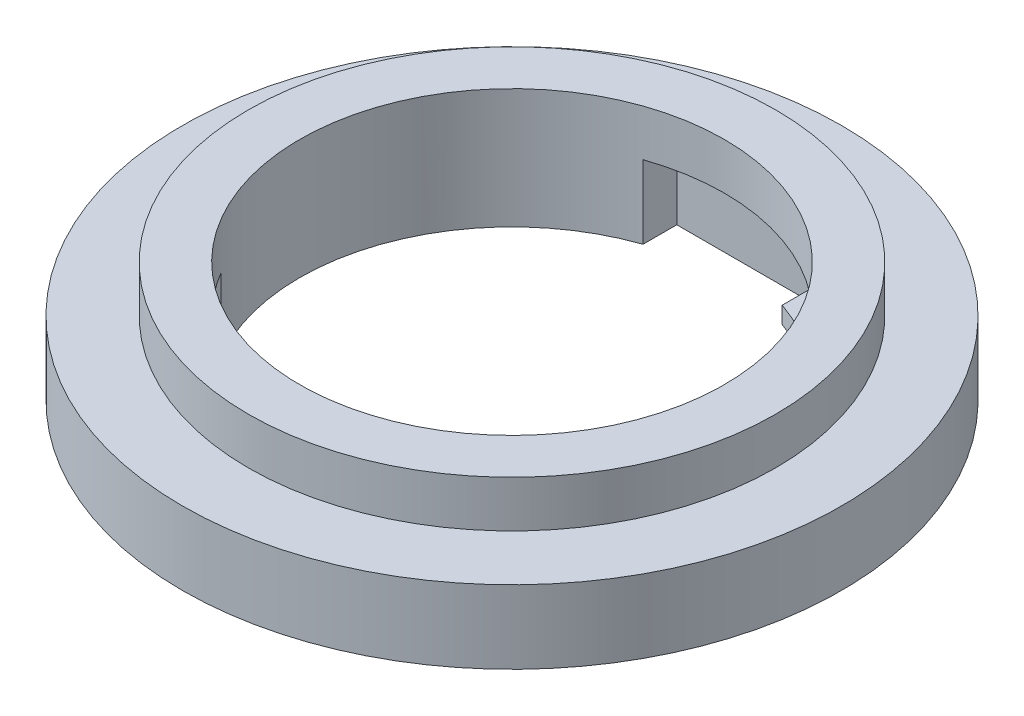
from build123d import *

# Parameters (mm, degrees)
SKETCH1_R           = 36
BOSS_EXTRUDE1_DEPTH = 6.35
SKETCH2_R           = 29
CUT_EXTRUDE1_DEPTH  = 52.306164347
BOSS_EXTRUDE2_START = 10
SKETCH3_R           = 45
SKETCH3_R_2         = 29
BOSS_EXTRUDE2_DEPTH = 10
CUT_EXTRUDE2_DEPTH  = 10
CUT_SWEEP1_START    = -7.7
CUT_SWEEP1_DEPTH    = 7.7
CUT_SWEEP2_START    = -7.7
CUT_SWEEP2_DEPTH    = 7.7


# Read off the part's stored shape, not the designer's step: Cut-Sweep1, Cut-Sweep2
with BuildPart() as part:
    # Sketch1 → Boss-Extrude1 (new body)
    with BuildSketch(Plane(origin=(0, 0, 0), x_dir=(1, 0, 0), z_dir=(0, 1, 0))):
        with Locations(Location((0, 0, 0), (0, 0, 270))):
            Circle(SKETCH1_R)
    extrude(amount=BOSS_EXTRUDE1_DEPTH)

    # Sketch2 → Cut-Extrude1 (cut, through all)
    with BuildSketch(Plane(origin=(0, 0, 0), x_dir=(-1, 0, 0), z_dir=(0, -1, 0))):
        with Locations(Location((0, 0, 0), (0, 0, 90))):
            Circle(SKETCH2_R)
    extrude(amount=-CUT_EXTRUDE1_DEPTH, mode=Mode.SUBTRACT)

    # Sketch3 → Boss-Extrude2 (add)
    with BuildSketch(Plane.XZ.offset(BOSS_EXTRUDE2_START)):
        with Locations(Location((0, 0, 0), (0, 0, 270))):
            Circle(SKETCH3_R)
        with Locations(Location((0, 0, 0), (0, 0, 270))):
            Circle(SKETCH3_R_2, mode=Mode.SUBTRACT)
    extrude(amount=-BOSS_EXTRUDE2_DEPTH)

    # Sketch6 → Cut-Extrude2 (cut)
    with BuildSketch(Plane(origin=(0, -10, 0), x_dir=(-1, 0, 0), z_dir=(0, -1, 0))):
        with BuildLine():
            Line((9.5, -29), (9.5, -27.399817518))
            ThreePointArc((9.5, -27.399817518), (0, -29), (-9.5, -27.399817518))
            Line((-9.5, -27.399817518), (-9.5, -29))
            Line((-9.5, -29), (-9.5, -32))
            Line((-9.5, -32), (9.5, -32))
            Line((9.5, -32), (9.5, -29))
        make_face()
        with BuildLine():
            Line((9.5, 29), (9.5, 27.399817518))
            ThreePointArc((9.5, 27.399817518), (0, 29), (-9.5, 27.399817518))
            Line((-9.5, 27.399817518), (-9.5, 29))
            Line((-9.5, 29), (-9.5, 32))
            Line((-9.5, 32), (9.5, 32))
            Line((9.5, 32), (9.5, 29))
        make_face()
    extrude(amount=-CUT_EXTRUDE2_DEPTH, mode=Mode.SUBTRACT)

    # Cut-Sweep1 outline → Cut-Sweep1 (cut)
    with BuildSketch(Plane(origin=(0, 0, 0), x_dir=(1, 0, 0), z_dir=(0, 1, 0)).offset(CUT_SWEEP1_START)):
        with BuildLine():
            add(Edge.make_bspline(
                [(9.5, 32), (13.238484468, 30.894081247), (16.809709604, 29.105075442), (23.154704566, 24.372448809), (25.850694666, 21.46020132), (27.956173262, 18.240130935)],
                knots=[0.04905898, 0.04905898, 0.04905898, 0.04905898, 0.52452949, 0.52452949, 1, 1, 1, 1], degree=3))
            Line((9.5, 32), (9.5, 27.399817518))
            ThreePointArc((9.5, 27.399817518), (18.365540323, 22.443416154), (24.978218037, 14.73392764))
            Line((24.978218037, 14.73392764), (27.956173262, 18.240130935))
        make_face()
    extrude(amount=CUT_SWEEP1_DEPTH, mode=Mode.SUBTRACT)

    # Cut-Sweep2 outline → Cut-Sweep2 (cut)
    with BuildSketch(Plane(origin=(0, 0, 0), x_dir=(1, 0, 0), z_dir=(0, 1, 0)).offset(CUT_SWEEP2_START)):
        with BuildLine():
            add(Edge.make_bspline(
                [(-9.5, -32), (-13.238484468, -30.894081248), (-16.809709604, -29.105075442), (-23.154704566, -24.372448809), (-25.850694666, -21.46020132), (-27.956173262, -18.240130935)],
                knots=[0.04905898, 0.04905898, 0.04905898, 0.04905898, 0.52452949, 0.52452949, 1, 1, 1, 1], degree=3))
            Line((-9.5, -32), (-9.5, -27.399817518))
            ThreePointArc((-9.5, -27.399817518), (-18.365540323, -22.443416154), (-24.978218037, -14.73392764))
            Line((-24.978218037, -14.73392764), (-27.956173262, -18.240130935))
        make_face()
    extrude(amount=CUT_SWEEP2_DEPTH, mode=Mode.SUBTRACT)


solid = part.part
